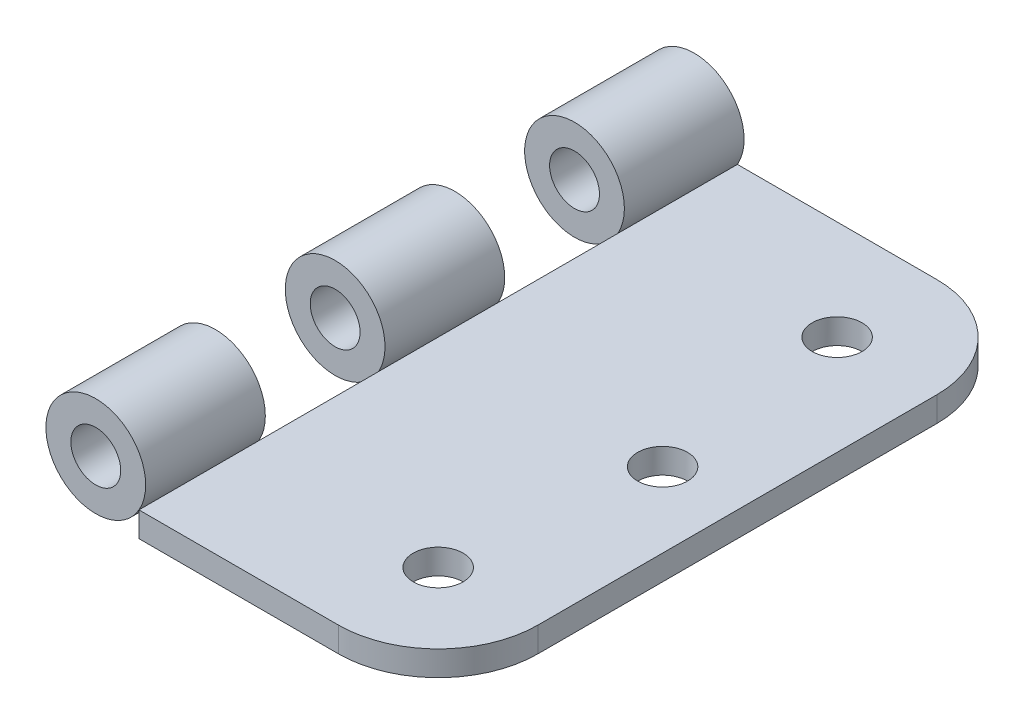
from build123d import *

# Parameters (mm, degrees)
SKETCH1_W           = 38.1
SKETCH1_H           = 76.2
BOSS_EXTRUDE1_DEPTH = 3.175
CUT_EXTRUDE1_REACH  = 87.253
SKETCH2_R           = 3.175
FILLET1_R           = 12.7
SKETCH3_R           = 6.35
SKETCH3_R_2         = 3.175
BOSS_EXTRUDE2_DEPTH = 15.24
BOSS_EXTRUDE3_START = -30.48
SKETCH3_2_R         = 6.35
SKETCH3_2_R_2       = 3.175
BOSS_EXTRUDE3_DEPTH = 15.24
BOSS_EXTRUDE4_START = -60.96
SKETCH3_3_R         = 6.35
SKETCH3_3_R_2       = 3.175
BOSS_EXTRUDE4_DEPTH = 15.24


with BuildPart() as part:
    # Sketch1 → Boss-Extrude1 (new body)
    with BuildSketch(Plane(origin=(0, 0, 0), x_dir=(1, 0, 0), z_dir=(0, 1, 0))):
        with Locations((19.05, 38.1)):
            Rectangle(SKETCH1_W, SKETCH1_H)
    extrude(amount=BOSS_EXTRUDE1_DEPTH)

    # Sketch2 → Cut-Extrude1 (cut, up to next)
    with BuildSketch(Plane(origin=(0, 3.175, 0), x_dir=(-1, 0, 0), z_dir=(0, 1, 0)), mode=Mode.PRIVATE) as cut_extrude1_sk1:
        with Locations((-25.4, -63.5)):
            Circle(SKETCH2_R)
    cut_extrude1_tool1 = extrude(cut_extrude1_sk1.sketch, amount=-CUT_EXTRUDE1_REACH, mode=Mode.PRIVATE) & part.part
    # Sketch2 → Cut-Extrude1 (cut, up to next)
    with BuildSketch(Plane(origin=(0, 3.175, 0), x_dir=(-1, 0, 0), z_dir=(0, 1, 0)), mode=Mode.PRIVATE) as cut_extrude1_sk2:
        with Locations((-28.575, -38.1)):
            Circle(SKETCH2_R)
    cut_extrude1_tool2 = extrude(cut_extrude1_sk2.sketch, amount=-CUT_EXTRUDE1_REACH, mode=Mode.PRIVATE) & part.part
    # Sketch2 → Cut-Extrude1 (cut, up to next)
    with BuildSketch(Plane(origin=(0, 3.175, 0), x_dir=(-1, 0, 0), z_dir=(0, 1, 0)), mode=Mode.PRIVATE) as cut_extrude1_sk3:
        with Locations((-25.4, -12.7)):
            Circle(SKETCH2_R)
    cut_extrude1_tool3 = extrude(cut_extrude1_sk3.sketch, amount=-CUT_EXTRUDE1_REACH, mode=Mode.PRIVATE) & part.part
    add(cut_extrude1_tool1.solids().sort_by_distance((25.4, 3.175, -63.5))[0], mode=Mode.SUBTRACT)
    add(cut_extrude1_tool2.solids().sort_by_distance((28.575, 3.175, -38.1))[0], mode=Mode.SUBTRACT)
    add(cut_extrude1_tool3.solids().sort_by_distance((25.4, 3.175, -12.7))[0], mode=Mode.SUBTRACT)

    # Fillet1
    fillet1_edges = [part.edges().sort_by_distance(p)[0] for p in [
        (38.1, 1.5875, 0),
        (38.1, 1.5875, -76.2),
    ]]
    fillet(fillet1_edges, radius=FILLET1_R)


with BuildPart() as body_2:
    # Sketch3 → Boss-Extrude2 (new body)
    with BuildSketch(Plane.XY):
        with Locations((-5.499261314, 6.35)):
            Circle(SKETCH3_R)
        with Locations((-5.499261314, 6.35)):
            Circle(SKETCH3_R_2, mode=Mode.SUBTRACT)
    extrude(amount=-BOSS_EXTRUDE2_DEPTH)


with BuildPart() as body_3:
    # Sketch3<2> → Boss-Extrude3 (new body)
    with BuildSketch(Plane.XY.offset(BOSS_EXTRUDE3_START)):
        with Locations((-5.499261314, 6.35)):
            Circle(SKETCH3_2_R)
        with Locations((-5.499261314, 6.35)):
            Circle(SKETCH3_2_R_2, mode=Mode.SUBTRACT)
    extrude(amount=-BOSS_EXTRUDE3_DEPTH)


with BuildPart() as body_4:
    # Sketch3<3> → Boss-Extrude4 (new body)
    with BuildSketch(Plane.XY.offset(BOSS_EXTRUDE4_START)):
        with Locations((-5.499261314, 6.35)):
            Circle(SKETCH3_3_R)
        with Locations((-5.499261314, 6.35)):
            Circle(SKETCH3_3_R_2, mode=Mode.SUBTRACT)
    extrude(amount=-BOSS_EXTRUDE4_DEPTH)


solid = Compound([part.part, body_2.part, body_3.part, body_4.part])
